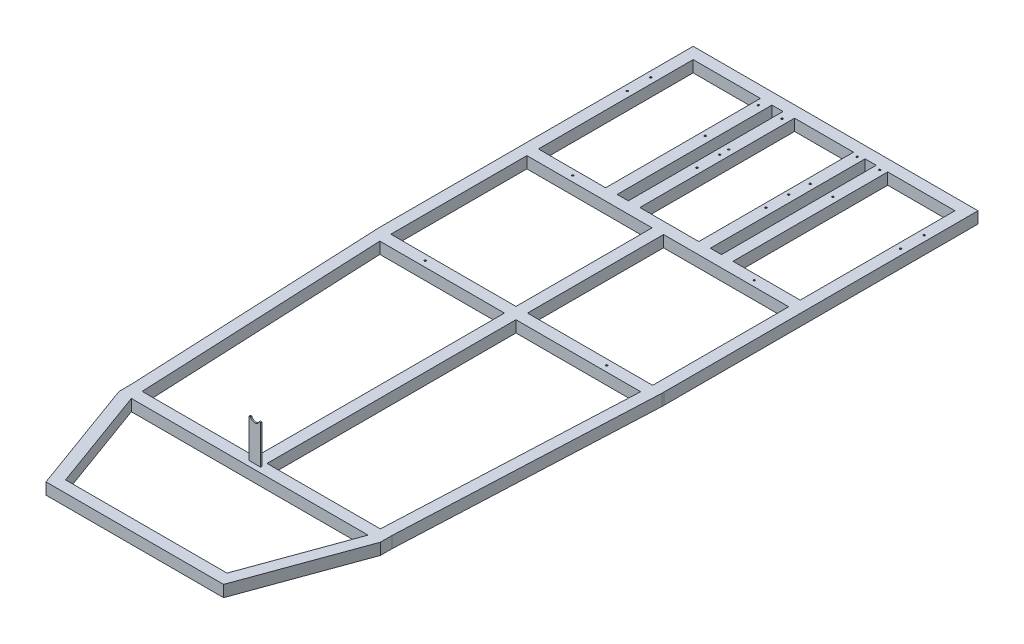
from build123d import *

# Parameters (mm, degrees)
BOSS_EXTRUDE1_DEPTH  = 25.4
SHELL1_START         = 1.6
SHELL1_DEPTH         = 22.2
SKETCH6_W            = 25.4
SKETCH6_H            = 100
BOSS_EXTRUDE6_DEPTH  = 54
CUT_EXTRUDE1_DEPTH   = 1670.737215852
SKETCH8_W            = 25.4
SKETCH8_H            = 25.4
SKETCH8_W_2          = 22.2
SKETCH8_H_2          = 22.2
BOSS_EXTRUDE7_DEPTH  = 577.2
SKETCH10_W           = 25.4
SKETCH10_H           = 228
CUT_EXTRUDE2_DEPTH   = 1669.739251849
SKETCH11_W           = 22.2
SKETCH11_H           = 22.2
BOSS_EXTRUDE9_DEPTH  = 1.6
SKETCH12_W           = 22.2
SKETCH12_H           = 22.2
BOSS_EXTRUDE10_DEPTH = 1.6
SKETCH13_W           = 100
SKETCH13_H           = 54
CUT_EXTRUDE3_DEPTH   = 1670.754188694
SKETCH16_W           = 25.4
SKETCH16_H           = 25.4
SKETCH16_W_2         = 22.2
SKETCH16_H_2         = 22.2
BOSS_EXTRUDE13_DEPTH = 341.199999999
SKETCH17_R           = 2
CUT_EXTRUDE4_DEPTH   = 1669.058707199
SKETCH21_W           = 25.4
SKETCH21_H           = 25.4
SKETCH21_W_2         = 22.2
SKETCH21_H_2         = 22.2
BOSS_EXTRUDE16_DEPTH = 874.300000001
BOSS_EXTRUDE17_REACH = 1581.475
SKETCH22_W           = 25.4
SKETCH22_H           = 25.4
SKETCH22_W_2         = 22.2
SKETCH22_H_2         = 22.2
BOSS_EXTRUDE18_REACH = 1581.466
SKETCH23_W           = 25.4
SKETCH23_H           = 25.4
SKETCH23_W_2         = 22.2
SKETCH23_H_2         = 22.2
SKETCH25_R           = 2
CUT_EXTRUDE5_DEPTH   = 1669.058707199
SKETCH26_W           = 25.4
SKETCH26_H           = 3
BOSS_EXTRUDE19_DEPTH = 250
CUT_EXTRUDE6_DEPTH   = 1500


# Read off the part's stored shape, not the designer's step: Shell1
with BuildPart() as part:
    # Sketch1 → Boss-Extrude1 (new body)
    with BuildSketch(Plane(origin=(0, 0, 0), x_dir=(1, 0, 0), z_dir=(0, 1, 0))):
        with BuildLine():
            Line((0, 0), (628, 0))
            Line((628, 0), (628, -691.999999966))
            ThreePointArc((628, -691.999999966), (628.045066634, -694.201055076), (627.993199893, -696.401960445))
            Line((627.993199893, -696.401960445), (602, -1266.3))
            Line((602, -1266.3), (602, -1291.7))
            Line((602, -1291.7), (509.769942637, -1545.1))
            Line((509.769942637, -1545.1), (118.230057363, -1545.1))
            Line((118.230057363, -1545.1), (26, -1291.7))
            Line((26, -1291.7), (26, -1266.3))
            Line((26, -1266.3), (0.050073927, -693.913543845))
            ThreePointArc((0.050073927, -693.913543845), (0.015878866, -692.957011573), (0, -691.999999999))
            Line((0, -691.999999999), (0, 0))
        make_face()
        with BuildLine():
            Line((51.426090012, -1266.3), (301.3, -1266.3))
            Line((301.3, -1266.3), (326.7, -1266.3))
            Line((326.7, -1266.3), (576.573593965, -1266.3))
            Line((576.573593965, -1266.3), (602.580961252, -696.091341878))
            ThreePointArc((602.580961252, -696.091341878), (602.632346303, -694.045865741), (602.6, -691.999999966))
            Line((602.6, -691.999999966), (602.6, -25.4))
            Line((602.6, -25.4), (326.7, -25.4))
            Line((326.7, -25.4), (301.3, -25.4))
            Line((301.3, -25.4), (25.4, -25.4))
            Line((25.4, -25.4), (25.4, -691.999999999))
            ThreePointArc((25.4, -691.999999999), (25.415362536, -692.514032413), (25.436011136, -693.027879633))
            Line((25.436011136, -693.027879633), (51.426090012, -1266.3))
        make_face(mode=Mode.SUBTRACT)
        Polygon((326.7, -1519.7), (491.984671166, -1519.7), (574.969884579, -1291.7), (326.7, -1291.7), align=None, mode=Mode.SUBTRACT)
        Polygon((53.030115421, -1291.7), (136.015328834, -1519.7), (301.3, -1519.7), (301.3, -1291.7), align=None, mode=Mode.SUBTRACT)
    extrude(amount=BOSS_EXTRUDE1_DEPTH)

    # Shell1 outline → Shell1 (cut)
    with BuildSketch(Plane(origin=(0, 0, 0), x_dir=(1, 0, 0), z_dir=(0, 1, 0)).offset(SHELL1_START)):
        with BuildLine():
            Line((1.6, -1.6), (1.6, -691.994339093))
            ThreePointArc((1.6, -691.994339093), (1.615404257, -692.917940683), (1.648432148, -693.84108008))
            Line((1.648432148, -693.84108008), (27.6, -1266.263749519))
            Line((27.6, -1266.263749519), (27.6, -1291.417876831))
            Line((27.6, -1291.417876831), (119.350389424, -1543.5))
            Line((119.350389424, -1543.5), (508.649610576, -1543.5))
            Line((508.649610576, -1543.5), (600.4, -1291.417876831))
            Line((600.4, -1291.417876831), (600.4, -1266.263530746))
            Line((600.4, -1266.263530746), (626.394861537, -696.329059811))
            ThreePointArc((626.394861537, -696.329059811), (626.445091652, -694.181723377), (626.4, -692.034272896))
            Line((626.4, -692.034272896), (626.4, -1.6))
            Line((626.4, -1.6), (1.6, -1.6))
        make_face()
        Polygon((134.894996772, -1521.3), (50.74507861, -1290.1), (302.9, -1290.1), (302.9, -1521.3), align=None, mode=Mode.SUBTRACT)
        Polygon((325.1, -1521.3), (325.1, -1290.1), (577.25492139, -1290.1), (493.105003228, -1521.3), align=None, mode=Mode.SUBTRACT)
        with BuildLine():
            Line((49.896984744, -1267.9), (23.837652915, -693.100343398))
            ThreePointArc((23.837652915, -693.100343398), (23.815995363, -692.560086828), (23.8, -692.019632983))
            Line((23.8, -692.019632983), (23.8, -23.8))
            Line((23.8, -23.8), (604.2, -23.8))
            Line((604.2, -23.8), (604.2, -691.971207865))
            ThreePointArc((604.2, -691.971207865), (604.232258854, -694.067935543), (604.179299607, -696.164242512))
            Line((604.179299607, -696.164242512), (578.102280915, -1267.9))
            Line((578.102280915, -1267.9), (49.896984744, -1267.9))
        make_face(mode=Mode.SUBTRACT)
    extrude(amount=SHELL1_DEPTH, mode=Mode.SUBTRACT)

    # Sketch6 → Boss-Extrude6 (add)
    with BuildSketch(Plane(origin=(0, 25.4, 0), x_dir=(1, 0, 0), z_dir=(0, 1, 0))):
        with Locations((12.7, -156)):
            Rectangle(SKETCH6_W, SKETCH6_H)
        with Locations((615.3, -156)):
            Rectangle(SKETCH6_W, SKETCH6_H)
    extrude(amount=BOSS_EXTRUDE6_DEPTH)

    # Sketch7 → Cut-Extrude1 (cut, through all)
    with BuildSketch(Plane(origin=(628, 0, 0), x_dir=(0, 0, -1), z_dir=(1, 0, 0))):
        with BuildLine():
            Line((-186, 79.4), (-186, 55.4))
            ThreePointArc((-186, 55.4), (-156, 25.4), (-126, 55.4))
            Line((-126, 55.4), (-126, 79.4))
            Line((-126, 79.4), (-186, 79.4))
        make_face()
    extrude(amount=-CUT_EXTRUDE1_DEPTH, mode=Mode.SUBTRACT)

    # Sketch8 → Boss-Extrude7 (add)
    with BuildSketch(Plane(origin=(25.4, 0, 0), x_dir=(0, 0, -1), z_dir=(1, 0, 0))):
        with Locations((-379.299999999, 12.7)):
            Rectangle(SKETCH8_W, SKETCH8_H)
        with Locations((-379.299999999, 12.7)):
            Rectangle(SKETCH8_W_2, SKETCH8_H_2, mode=Mode.SUBTRACT)
    extrude(amount=BOSS_EXTRUDE7_DEPTH)

    # Sketch10 → Cut-Extrude2 (cut, through all)
    with BuildSketch(Plane(origin=(0, 25.4, 0), x_dir=(1, 0, 0), z_dir=(0, 1, 0))):
        with Locations((314, -1405.7)):
            Rectangle(SKETCH10_W, SKETCH10_H)
    extrude(amount=-CUT_EXTRUDE2_DEPTH, mode=Mode.SUBTRACT)

    # Sketch11 → Boss-Extrude9 (add)
    with BuildSketch(Plane(origin=(0, 0, 1519.7), x_dir=(-1, 0, 0), z_dir=(0, 0, -1))):
        with Locations((-314, 12.7)):
            Rectangle(SKETCH11_W, SKETCH11_H)
    extrude(amount=-BOSS_EXTRUDE9_DEPTH)

    # Sketch12 → Boss-Extrude10 (add)
    with BuildSketch(Plane.XY.offset(1291.7)):
        with Locations((314, 12.7)):
            Rectangle(SKETCH12_W, SKETCH12_H)
    extrude(amount=-BOSS_EXTRUDE10_DEPTH)

    # Sketch13 → Cut-Extrude3 (cut, through all)
    with BuildSketch(Plane.ZY):
        with Locations((156, 52.4)):
            Rectangle(SKETCH13_W, SKETCH13_H)
    extrude(amount=-CUT_EXTRUDE3_DEPTH, mode=Mode.SUBTRACT)

    # Sketch16 → Boss-Extrude13 (add)
    # profile 1 of 4: a face of its own
    with BuildSketch(Plane.XY.offset(25.4)):
        with Locations((186.3, 12.7)):
            Rectangle(SKETCH16_W, SKETCH16_H)
        with Locations((186.3, 12.7)):
            Rectangle(SKETCH16_W_2, SKETCH16_H_2, mode=Mode.SUBTRACT)
    # profile 2 of 4: a face of its own
    with BuildSketch(Plane.XY.offset(25.4)):
        with Locations((236.3, 12.7)):
            Rectangle(SKETCH16_W, SKETCH16_H)
        with Locations((236.3, 12.7)):
            Rectangle(SKETCH16_W_2, SKETCH16_H_2, mode=Mode.SUBTRACT)
    # profile 3 of 4: a face of its own
    with BuildSketch(Plane.XY.offset(25.4)):
        with Locations((391.7, 12.7)):
            Rectangle(SKETCH16_W, SKETCH16_H)
        with Locations((391.7, 12.7)):
            Rectangle(SKETCH16_W_2, SKETCH16_H_2, mode=Mode.SUBTRACT)
    # profile 4 of 4: a face of its own
    with BuildSketch(Plane.XY.offset(25.4)):
        with Locations((441.7, 12.7)):
            Rectangle(SKETCH16_W, SKETCH16_H)
        with Locations((441.7, 12.7)):
            Rectangle(SKETCH16_W_2, SKETCH16_H_2, mode=Mode.SUBTRACT)
    extrude(amount=BOSS_EXTRUDE13_DEPTH)

    # Sketch17 → Cut-Extrude4 (cut, through all)
    with BuildSketch(Plane(origin=(0, 25.4, 0), x_dir=(1, 0, 0), z_dir=(0, 1, 0))):
        with Locations(Location((615.3, -106, 0), (0, 0, 270))):
            Circle(SKETCH17_R)
        with Locations(Location((615.3, -158, 0), (0, 0, 270))):
            Circle(SKETCH17_R)
        with Locations(Location((236.3, -40.4, 0), (0, 0, 270))):
            Circle(SKETCH17_R)
        with Locations(Location((236.3, -157.8, 0), (0, 0, 270))):
            Circle(SKETCH17_R)
        with Locations(Location((184.3, -40.4, 0), (0, 0, 270))):
            Circle(SKETCH17_R)
        with Locations(Location((184.3, -157.8, 0), (0, 0, 270))):
            Circle(SKETCH17_R)
        with Locations(Location((12.7, -106, 0), (0, 0, 270))):
            Circle(SKETCH17_R)
        with Locations(Location((12.7, -158, 0), (0, 0, 270))):
            Circle(SKETCH17_R)
        with Locations(Location((391.7, -30.4, 0), (0, 0, 270))):
            Circle(SKETCH17_R)
        with Locations(Location((441.7, -30.4, 0), (0, 0, 270))):
            Circle(SKETCH17_R)
        with Locations(Location((391.7, -133.46, 0), (0, 0, 270))):
            Circle(SKETCH17_R)
        with Locations(Location((441.7, -133.46, 0), (0, 0, 270))):
            Circle(SKETCH17_R)
        with Locations(Location((236.3, -227.8, 0), (0, 0, 270))):
            Circle(SKETCH17_R)
        with Locations(Location((388.35, -227.8, 0), (0, 0, 270))):
            Circle(SKETCH17_R)
        with Locations(Location((236.3, -177.8, 0), (0, 0, 270))):
            Circle(SKETCH17_R)
        with Locations(Location((388.35, -177.8, 0), (0, 0, 270))):
            Circle(SKETCH17_R)
    extrude(amount=-CUT_EXTRUDE4_DEPTH, mode=Mode.SUBTRACT)

    # Sketch21 → Boss-Extrude16 (add)
    with BuildSketch(Plane.XY.offset(391.999999999)):
        with Locations((314, 12.7)):
            Rectangle(SKETCH21_W, SKETCH21_H)
        with Locations((314, 12.7)):
            Rectangle(SKETCH21_W_2, SKETCH21_H_2, mode=Mode.SUBTRACT)
    extrude(amount=BOSS_EXTRUDE16_DEPTH)

    # Boss-Extrude17: up to this plane
    boss_extrude17_end = Plane(origin=(51.426090012, 25.4, 1266.3), z_dir=(0.9989738881478828, 0, -0.04528985315389523))
    # Sketch22 → Boss-Extrude17 (add, up to the surface)
    with BuildSketch(Plane.ZY.offset(-301.3), mode=Mode.PRIVATE) as boss_extrude17_sk1:
        with Locations((704.699999999, 12.7)):
            Rectangle(SKETCH22_W, SKETCH22_H)
        with Locations((704.699999999, 12.7)):
            Rectangle(SKETCH22_W_2, SKETCH22_H_2, mode=Mode.SUBTRACT)
    boss_extrude17_tool1 = split(extrude(boss_extrude17_sk1.sketch, amount=BOSS_EXTRUDE17_REACH, mode=Mode.PRIVATE), bisect_by=boss_extrude17_end, keep=Keep.BOTH, mode=Mode.PRIVATE)
    add(boss_extrude17_tool1.solids().sort_by_distance((301.3, 25.04079, 704.7))[0])

    # Boss-Extrude18: up to this plane
    boss_extrude18_end = Plane(origin=(576.573593965, 25.4, 1266.3), z_dir=(-0.9989614719742947, 0, -0.04556289620898221))
    # Sketch23 → Boss-Extrude18 (add, up to the surface)
    with BuildSketch(Plane(origin=(326.7, 0, 0), x_dir=(0, 0, -1), z_dir=(1, 0, 0)), mode=Mode.PRIVATE) as boss_extrude18_sk1:
        with Locations((-704.699999999, 12.7)):
            Rectangle(SKETCH23_W, SKETCH23_H)
        with Locations((-704.699999999, 12.7)):
            Rectangle(SKETCH23_W_2, SKETCH23_H_2, mode=Mode.SUBTRACT)
    boss_extrude18_tool1 = split(extrude(boss_extrude18_sk1.sketch, amount=BOSS_EXTRUDE18_REACH, mode=Mode.PRIVATE), bisect_by=boss_extrude18_end, keep=Keep.BOTH, mode=Mode.PRIVATE)
    add(boss_extrude18_tool1.solids().sort_by_distance((326.7, 25.04079, 704.7))[0])

    # Sketch25 → Cut-Extrude5 (cut, through all)
    with BuildSketch(Plane(origin=(0, 25.4, 0), x_dir=(1, 0, 0), z_dir=(0, 1, 0))):
        with Locations(Location((114, -704.699999999, 0), (0, 0, 270))):
            Circle(SKETCH25_R)
        with Locations(Location((514, -704.699999999, 0), (0, 0, 270))):
            Circle(SKETCH25_R)
        with Locations(Location((514, -379.299999999, 0), (0, 0, 270))):
            Circle(SKETCH25_R)
        with Locations(Location((114, -379.299999999, 0), (0, 0, 270))):
            Circle(SKETCH25_R)
    extrude(amount=-CUT_EXTRUDE5_DEPTH, mode=Mode.SUBTRACT)

    # Sketch26 → Boss-Extrude19 (add)
    with BuildSketch(Plane(origin=(0, 25.4, 0), x_dir=(1, 0, 0), z_dir=(0, 1, 0))):
        with Locations((314, -1279)):
            Rectangle(SKETCH26_W, SKETCH26_H)
    extrude(amount=BOSS_EXTRUDE19_DEPTH)

    # Sketch27 → Cut-Extrude6 (cut)
    with BuildSketch(Plane.XY.offset(1280.5)):
        with BuildLine():
            Line((304.47, 110.4), (301.3, 110.4))
            Line((301.3, 110.4), (301.3, 275.4))
            Line((301.3, 275.4), (326.7, 275.4))
            Line((326.7, 275.4), (326.7, 110.4))
            Line((326.7, 110.4), (323.53, 110.4))
            ThreePointArc((323.53, 110.4), (314, 103.654777996), (304.47, 110.4))
        make_face()
    extrude(amount=-CUT_EXTRUDE6_DEPTH, mode=Mode.SUBTRACT)


solid = part.part
